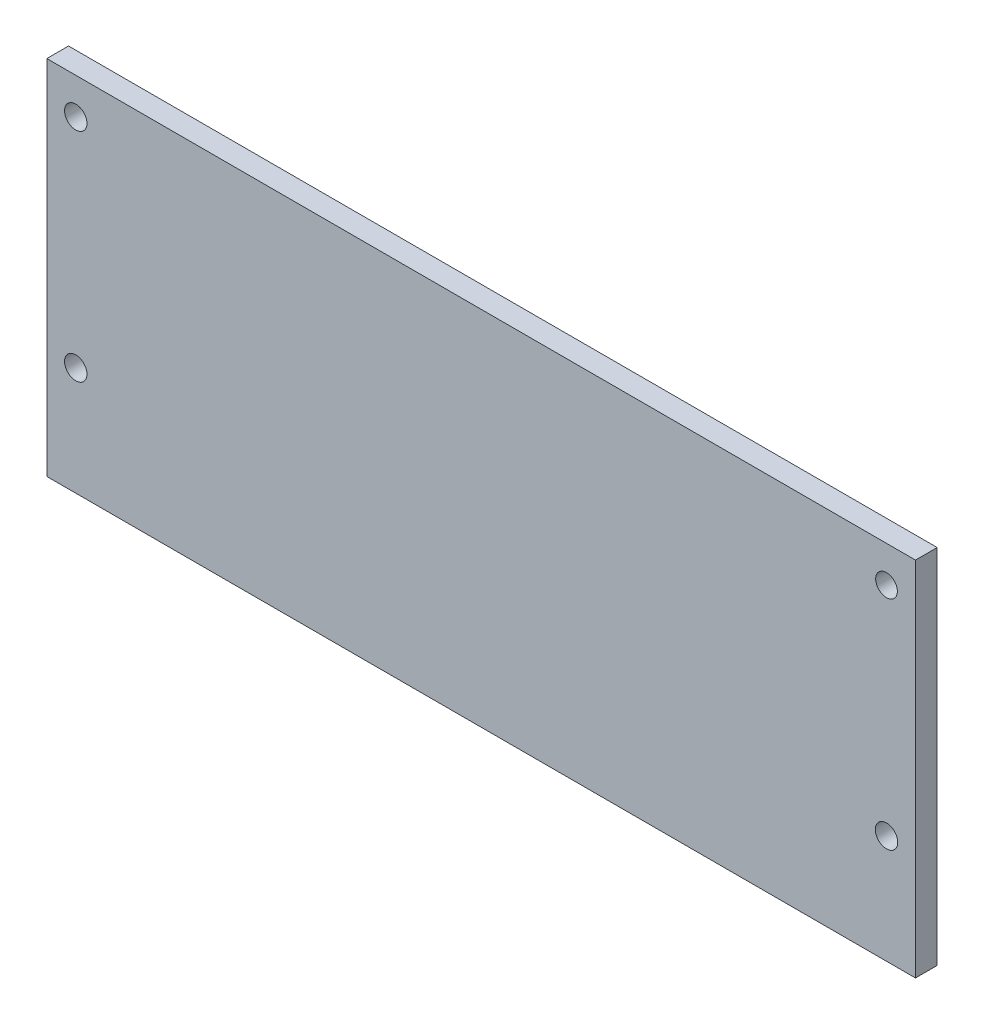
from build123d import *

# Parameters (mm, degrees)
SKETCH_1_W          = 120
SKETCH_1_H          = 50
EXTRUDE_1_DEPTH     = 3
SKETCH_3_R          = 1.5
SKETCH_3_R_2        = 1.55
CUT_EXTRUDE_2_DEPTH = 10
SKETCH_4_R          = 1.55
CUT_EXTRUDE_3_DEPTH = 10


with BuildPart() as part:
    # 草图1 → 凸台-拉伸1 (new body)
    with BuildSketch(Plane.XY):
        Rectangle(SKETCH_1_W, SKETCH_1_H)
    extrude(amount=EXTRUDE_1_DEPTH)

    # 草图3 → 切除-拉伸2 (cut)
    with BuildSketch(Plane(origin=(0, 0, 0), x_dir=(-1, 0, 0), z_dir=(0, 0, -1))):
        with Locations((-56, 20)):
            Circle(SKETCH_3_R)
        with Locations((56, 20)):
            Circle(SKETCH_3_R_2)
    extrude(amount=-CUT_EXTRUDE_2_DEPTH, mode=Mode.SUBTRACT)

    # 草图4 → 切除-拉伸3 (cut)
    with BuildSketch(Plane.XY.offset(3)):
        with Locations((-56, -10)):
            Circle(SKETCH_4_R)
        with Locations((56, -10)):
            Circle(SKETCH_4_R)
    extrude(amount=-CUT_EXTRUDE_3_DEPTH, mode=Mode.SUBTRACT)


solid = part.part
